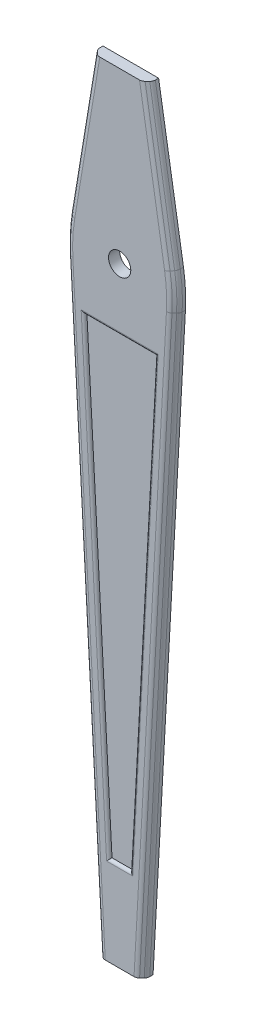
from build123d import *

# Parameters (mm, degrees)
SKETCH_1_R          = 0.2
EXTRUDE_1_DEPTH     = 0.2
CHAMFER_1_SIZE      = 0.1
CUT_EXTRUDE_1_DEPTH = 0.05
FILLET_1_R          = 0.1
FILLET_2_R          = 0.05


with BuildPart() as part:
    # Эскиз1 → Бобышка-Вытянуть1 (new body)
    with BuildSketch(Plane.XY):
        with BuildLine():
            Line((-0.946791834, 0.323505648), (-0.5, 3.04))
            Line((-0.5, 3.04), (0.5, 3.04))
            Line((0.5, 3.04), (0.946791834, 0.323505648))
            ThreePointArc((0.946791834, 0.323505648), (0.982164861, -0.000966935), (0.982078726, -0.327361942))
            Line((0.982078726, -0.327361942), (0.4, -10.96))
            Line((0.4, -10.96), (-0.4, -10.96))
            Line((-0.4, -10.96), (-0.982078726, -0.327361942))
            ThreePointArc((-0.982078726, -0.327361942), (-0.982164861, -0.000966935), (-0.946791834, 0.323505648))
        make_face()
        Circle(SKETCH_1_R, mode=Mode.SUBTRACT)
    extrude(amount=EXTRUDE_1_DEPTH)

    # Фаска1
    chamfer_1_edges = [part.edges().sort_by_distance(p)[0] for p in [
        (0.723395917, 1.681752824, 0.2),
        (-0.723395917, 1.681752824, 0.2),
        (-0.982164861, -0.000966935, 0.2),
        (-0.691039363, -5.643680971, 0.2),
        (0.691039363, -5.643680971, 0.2),
        (0.982164861, -0.000966935, 0.2),
    ]]
    chamfer(chamfer_1_edges, length=CHAMFER_1_SIZE)

    # Эскиз2 → Вырез-Вытянуть1 (cut)
    with BuildSketch(Plane.XY.offset(0.2)):
        Polygon((-0.638861233, -1.108595936), (-0.187234527, -9.358310432), (0.187234527, -9.358310432), (0.638861233, -1.108595936), align=None)
    extrude(amount=-CUT_EXTRUDE_1_DEPTH, mode=Mode.SUBTRACT)

    # Скругление1
    fillet_1_edges = [part.edges().sort_by_distance(p)[0] for p in [
        (-0.591039251, -5.640947837, 0.2),
        (-0.882311502, -0.006380501, 0.2),
        (-0.623387011, 1.673638165, 0.2),
        (0.623387011, 1.673638165, 0.2),
        (0.882311502, -0.006380501, 0.2),
        (0.591039251, -5.640947837, 0.2),
        (0.691039363, -5.643680971, 0.1),
        (0.982164861, -0.000966935, 0.1),
        (0.723395917, 1.681752824, 0.1),
        (-0.723395917, 1.681752824, 0.1),
        (-0.982164861, -0.000966935, 0.1),
        (-0.691039363, -5.643680971, 0.1),
    ]]
    fillet(fillet_1_edges, radius=FILLET_1_R)

    # Скругление2
    fillet_2_edges = [part.edges().sort_by_distance(p)[0] for p in [
        (0, -9.358310432, 0.2),
        (-0.41304788, -5.233453184, 0.2),
        (0.41304788, -5.233453184, 0.2),
        (0, -1.108595936, 0.2),
    ]]
    fillet(fillet_2_edges, radius=FILLET_2_R - 0.0001)  # a hair under: the kernel refuses the full size


solid = part.part
